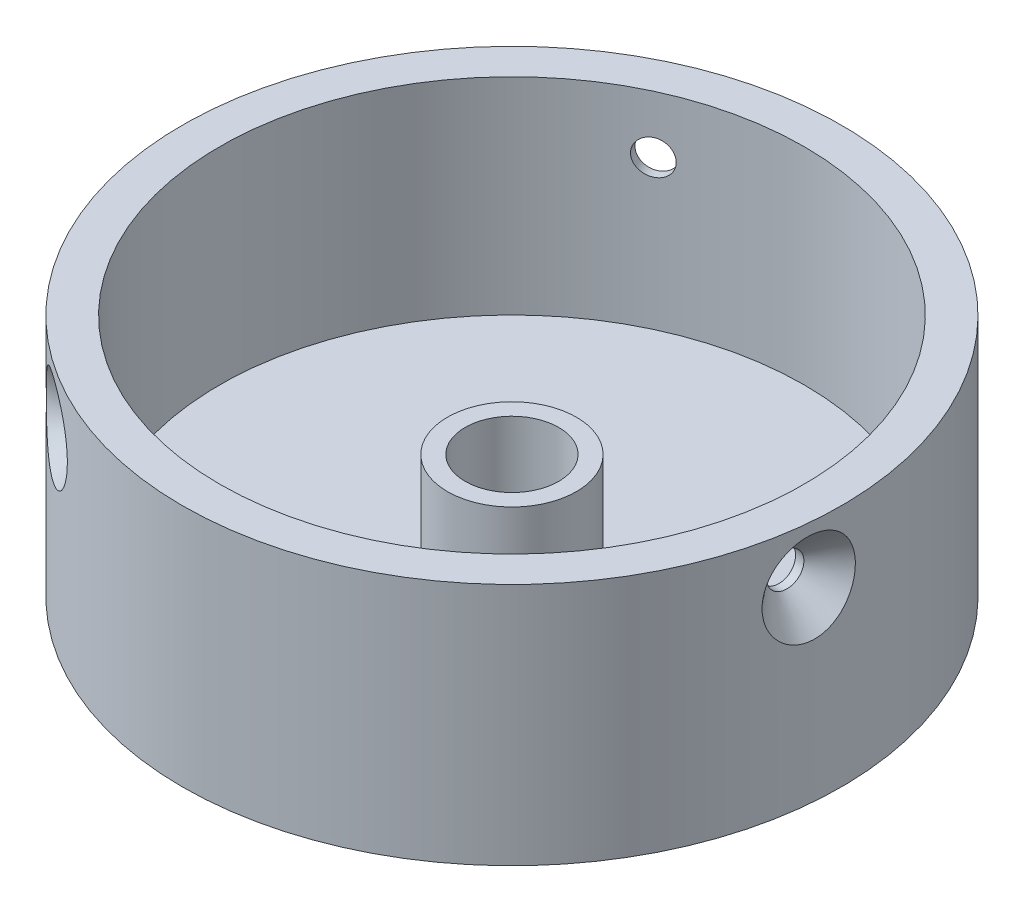
from build123d import *

# Parameters (mm, degrees)
SKETCH1_R           = 23
BOSS_EXTRUDE1_DEPTH = 17
SHELL1_T            = -2.6
SKETCH2_W           = 6
SKETCH2_H           = 23
BOSS_EXTRUDE2_DEPTH = 6
SKETCH3_W           = 2
SKETCH3_H           = 3
CUT_EXTRUDE1_DEPTH  = 50.989999
SKETCH4_R           = 4.5
BOSS_EXTRUDE3_DEPTH = 6
SKETCH5_R           = 3.265
CUT_EXTRUDE2_DEPTH  = 13
SKETCH7_W           = 3.82
SKETCH7_H           = 2.6
CUT_EXTRUDE3_DEPTH  = 1.71
CIRPATTERN1_COUNT   = 3
SKETCH10_W          = 3.1
SKETCH10_H          = 2.2
CUT_EXTRUDE4_DEPTH  = 3
BOSS_EXTRUDE6_REACH = 40.663
SKETCH11_W          = 3.1
SKETCH11_H          = 1.188042875
FILLET1_R           = 2


with BuildPart() as part:
    # Sketch1 → Boss-Extrude1 (new body)
    with BuildSketch(Plane(origin=(0, 0, 0), x_dir=(1, 0, 0), z_dir=(0, 1, 0))):
        with Locations(Location((0, 0, 0), (0, 0, 270))):
            Circle(SKETCH1_R)
    extrude(amount=BOSS_EXTRUDE1_DEPTH)

    # Shell1
    shell1_openings = [part.faces().sort_by_distance(p)[0] for p in [
        (0, 17, 0),
    ]]
    offset(amount=SHELL1_T, openings=shell1_openings, kind=Kind.INTERSECTION)

    # Sketch2 → Boss-Extrude2 (add)
    with BuildSketch(Plane.XZ):
        with Locations((-3, -6.5)):
            Rectangle(SKETCH2_W, SKETCH2_H)
        with Locations((3, -6.5)):
            Rectangle(SKETCH2_W, SKETCH2_H)
    extrude(amount=BOSS_EXTRUDE2_DEPTH)

    # Sketch3 → Cut-Extrude1 (cut, through all)
    with BuildSketch(Plane(origin=(0, 0, -18), x_dir=(-1, 0, 0), z_dir=(0, 0, -1))):
        with Locations((-5, -1.5)):
            Rectangle(SKETCH3_W, SKETCH3_H)
        with Locations((5, -1.5)):
            Rectangle(SKETCH3_W, SKETCH3_H)
    extrude(amount=-CUT_EXTRUDE1_DEPTH, mode=Mode.SUBTRACT)

    # Sketch4 → Boss-Extrude3 (add)
    with BuildSketch(Plane(origin=(0, 2.6, 0), x_dir=(1, 0, 0), z_dir=(0, 1, 0))):
        with Locations(Location((0, 0, 0), (0, 0, 270))):
            Circle(SKETCH4_R)
    extrude(amount=BOSS_EXTRUDE3_DEPTH)

    # Sketch5 → Cut-Extrude2 (cut)
    with BuildSketch(Plane(origin=(0, 8.6, 0), x_dir=(1, 0, 0), z_dir=(0, 1, 0))):
        with Locations(Location((0, 0, 0), (0, 0, 270))):
            Circle(SKETCH5_R)
    extrude(amount=-CUT_EXTRUDE2_DEPTH, mode=Mode.SUBTRACT)

    # Sketch7 → Cut-Extrude3 (cut)
    with BuildSketch(Plane.XY.offset(5)):
        with Locations((0, -3)):
            Rectangle(SKETCH7_W, SKETCH7_H)
    extrude(amount=-CUT_EXTRUDE3_DEPTH, mode=Mode.SUBTRACT)

    # Sketch9 → CSK SLOT for M2 Countersunk Flat Head Screw1 (revolve, cut)
    with BuildSketch(Plane(origin=(22.911051483, 13, 2.020821599), x_dir=(0.08786180866791495, 0, -0.9961326731804369), z_dir=(0, 1, 0))):
        Polygon((0, 0), (0, 5.721032743), (1.2, 5), (1.2, 2), (3.2, 0), align=None)
    csk_slot_for_m2_countersunk_flat_head_sc = revolve(axis=Axis((29.236493958, 13, 2.578744084), (-0.9961326731804366, 0, -0.08786180866791493)), mode=Mode.SUBTRACT)

    # CirPattern1: CSK SLOT for M2 Countersunk Flat Head Screw1 ×3 about axis
    cirpattern1_axis = Axis((0, 17, 0), (0, -1, 0))
    for i in range(1, CIRPATTERN1_COUNT):
        add(csk_slot_for_m2_countersunk_flat_head_sc.rotate(cirpattern1_axis, i * 360 / CIRPATTERN1_COUNT), mode=Mode.SUBTRACT)

    # Sketch10 → Cut-Extrude4 (cut)
    with BuildSketch(Plane.XY.offset(3.29)):
        with Locations((0, -2.8)):
            Rectangle(SKETCH10_W, SKETCH10_H)
    extrude(amount=-CUT_EXTRUDE4_DEPTH, mode=Mode.SUBTRACT)

    # Sketch11 → Boss-Extrude6 (add, up to next)
    with BuildSketch(Plane(origin=(0, -3.9, 0), x_dir=(1, 0, 0), z_dir=(0, 1, 0)), mode=Mode.PRIVATE) as boss_extrude6_sk1:
        with Locations((0, -2.695978563)):
            Rectangle(SKETCH11_W, SKETCH11_H)
    boss_extrude6_tool1 = extrude(boss_extrude6_sk1.sketch, amount=-BOSS_EXTRUDE6_REACH, mode=Mode.PRIVATE) - part.part
    add(boss_extrude6_tool1.solids().sort_by_distance((0, -3.9, 2.695979))[0])

    # Fillet1
    # the kernel refuses this fillet: 2 mm, written as the material it takes off along each edge
    with BuildSketch(Plane(origin=(-6, 2, 5), x_dir=(1, 0, 0), z_dir=(0, -1, 0))) as fillet1_piece_1_section:
        with BuildLine():
            CenterArc((FILLET1_R, -FILLET1_R), FILLET1_R, 90, 90)
            Line((0, -FILLET1_R), (0, 0))
            Line((0, 0), (FILLET1_R, 0))
        make_face()
    fillet1_piece_1 = extrude(amount=13, mode=Mode.PRIVATE)
    fillet1_piece_1 = split(fillet1_piece_1, bisect_by=Plane(origin=(-5.547209771, 0, 4.547209771), z_dir=(0, -1, 0)), keep=Keep.TOP, mode=Mode.PRIVATE)
    add(fillet1_piece_1, mode=Mode.SUBTRACT)
    with BuildSketch(Plane(origin=(-11, -6, 5), x_dir=(0, 1, 0), z_dir=(1, 0, 0))) as fillet1_piece_2:
        with BuildLine():
            CenterArc((FILLET1_R, -FILLET1_R), FILLET1_R, 90, 90)
            Line((0, -FILLET1_R), (0, 0))
            Line((0, 0), (FILLET1_R, 0))
        make_face()
    extrude(amount=22, mode=Mode.SUBTRACT)
    with BuildSketch(Plane(origin=(6, 2, 5), x_dir=(-1, 0, 0), z_dir=(0, -1, 0))) as fillet1_piece_3_section:
        with BuildLine():
            CenterArc((FILLET1_R, FILLET1_R), FILLET1_R, 180, 90)
            Line((0, FILLET1_R), (0, 0))
            Line((0, 0), (FILLET1_R, 0))
        make_face()
    fillet1_piece_3 = extrude(amount=13, mode=Mode.PRIVATE)
    fillet1_piece_3 = split(fillet1_piece_3, bisect_by=Plane(origin=(5.547209771, 0, 4.547209771), z_dir=(0, -1, 0)), keep=Keep.TOP, mode=Mode.PRIVATE)
    add(fillet1_piece_3, mode=Mode.SUBTRACT)


solid = part.part
